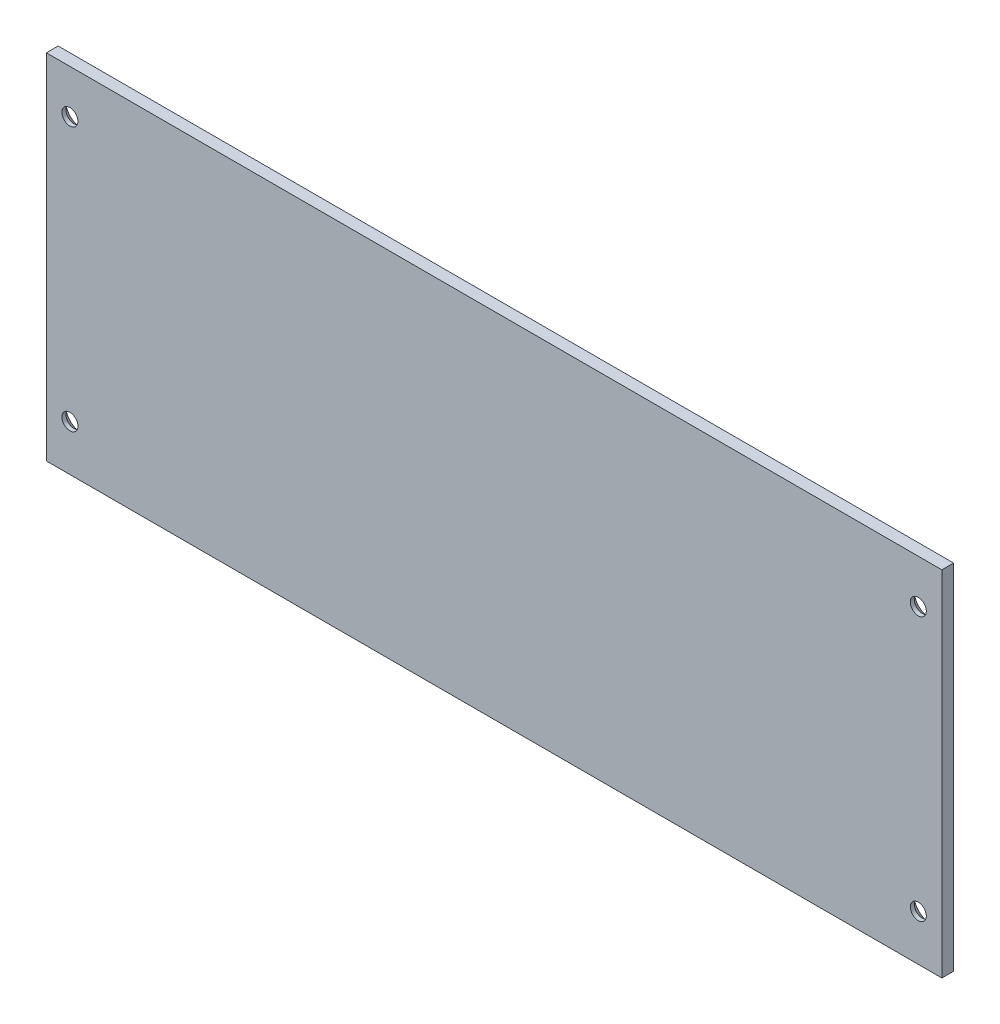
from build123d import *

# Parameters (mm, degrees)
SKETCH1_W                                            = 190
SKETCH1_H                                            = 75
BOSS_EXTRUDE1_DEPTH                                  = 2.5
AVELLANADO_PARA_TORNILLO_CON_CABEZA_AVEL_D           = 3.4
AVELLANADO_PARA_TORNILLO_CON_CABEZA_AVEL_DEPTH       = 7.5
AVELLANADO_PARA_TORNILLO_CON_CABEZA_AVEL_CSINK_D     = 6.8
AVELLANADO_PARA_TORNILLO_CON_CABEZA_AVEL_CSINK_ANGLE = 92
AVELLANADO_PARA_TORNILLO_CON_CABEZA_AVEL_TIP         = 1.021463052


with BuildPart() as part:
    # Sketch1 → Boss-Extrude1 (new body)
    with BuildSketch(Plane.XY):
        with Locations((95, 37.5)):
            Rectangle(SKETCH1_W, SKETCH1_H)
    extrude(amount=BOSS_EXTRUDE1_DEPTH)

    # Avellanado para tornillo con cabeza avellanada en cruz elevada de M31
    with Locations(Plane(origin=(0, 0, 0), x_dir=(-1, 0, 0), z_dir=(0, 0, -1))):
        with Locations((-5, 65.742482901), (-5, 9.741024526), (-185, 9.741024526), (-185, 65.742482901)):
            CounterSinkHole(AVELLANADO_PARA_TORNILLO_CON_CABEZA_AVEL_D / 2, AVELLANADO_PARA_TORNILLO_CON_CABEZA_AVEL_CSINK_D / 2, depth=AVELLANADO_PARA_TORNILLO_CON_CABEZA_AVEL_DEPTH, counter_sink_angle=AVELLANADO_PARA_TORNILLO_CON_CABEZA_AVEL_CSINK_ANGLE)
            with Locations((0, 0, -(AVELLANADO_PARA_TORNILLO_CON_CABEZA_AVEL_DEPTH + AVELLANADO_PARA_TORNILLO_CON_CABEZA_AVEL_TIP / 2))):  # 118° drill point
                Cone(0, AVELLANADO_PARA_TORNILLO_CON_CABEZA_AVEL_D / 2, AVELLANADO_PARA_TORNILLO_CON_CABEZA_AVEL_TIP, mode=Mode.SUBTRACT)


solid = part.part
